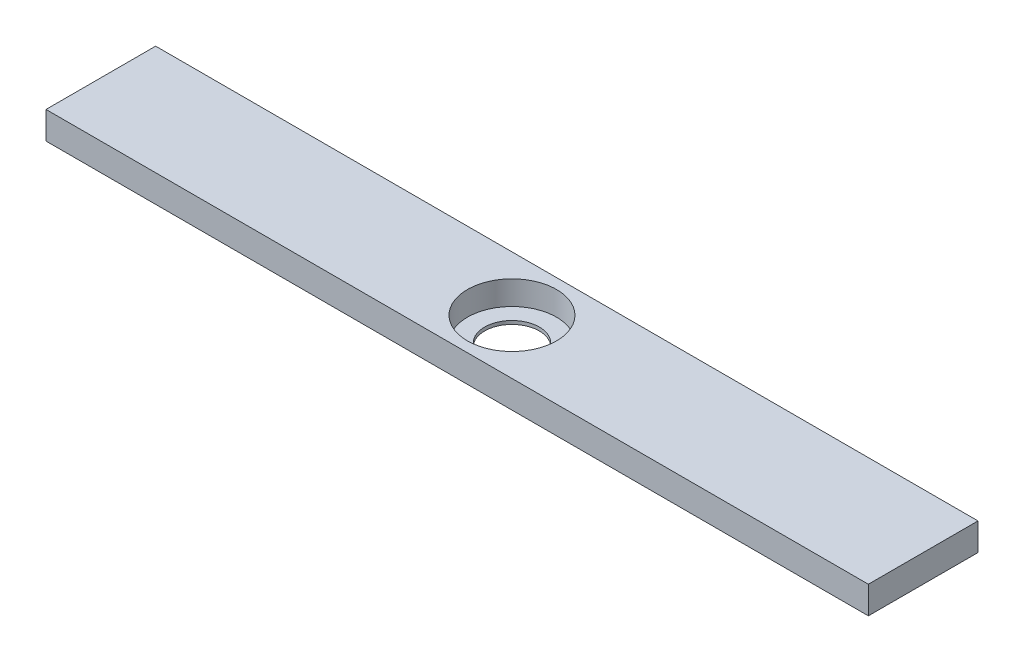
from build123d import *

# Parameters (mm, degrees)
SKETCH1_W           = 381
SKETCH1_H           = 50.8
BOSS_EXTRUDE1_DEPTH = 12.7
SKETCH2_R           = 20.6375
CUT_EXTRUDE1_DEPTH  = 11.1125
SKETCH3_R           = 12.7
CUT_EXTRUDE2_DEPTH  = 193.506876906


with BuildPart() as part:
    # Sketch1 → Boss-Extrude1 (new body)
    with BuildSketch(Plane(origin=(0, 0, 0), x_dir=(1, 0, 0), z_dir=(0, 1, 0))):
        Rectangle(SKETCH1_W, SKETCH1_H)
    extrude(amount=BOSS_EXTRUDE1_DEPTH)

    # Sketch2 → Cut-Extrude1 (cut)
    with BuildSketch(Plane(origin=(0, 12.7, 0), x_dir=(1, 0, 0), z_dir=(0, 1, 0))):
        Circle(SKETCH2_R)
    extrude(amount=-CUT_EXTRUDE1_DEPTH, mode=Mode.SUBTRACT)

    # Sketch3 → Cut-Extrude2 (cut, through all)
    with BuildSketch(Plane(origin=(0, 1.5875, 0), x_dir=(1, 0, 0), z_dir=(0, 1, 0))):
        Circle(SKETCH3_R)
    extrude(amount=-CUT_EXTRUDE2_DEPTH, mode=Mode.SUBTRACT)


solid = part.part
